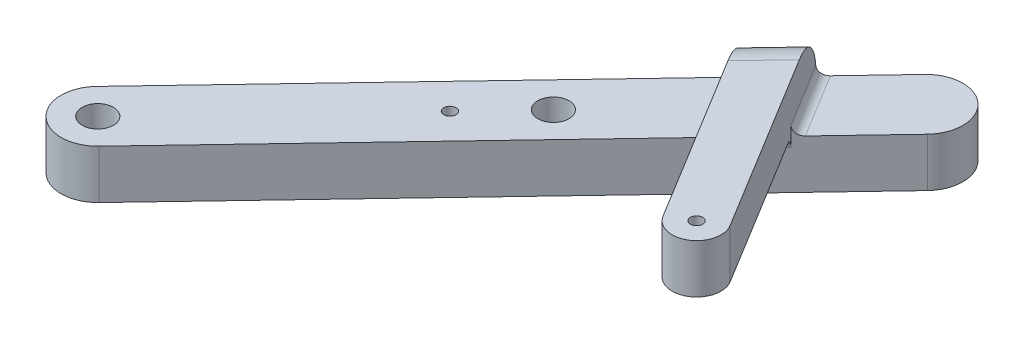
from build123d import *

# Parameters (mm, degrees)
SKETCH1_R           = 3.2000000000000006
SKETCH1_R_2         = 3.2000000000000037
SKETCH1_R_3         = 1.2500000000000047
BOSS_EXTRUDE1_DEPTH = 10
SKETCH1_7_R         = 1.2500000000000122
BOSS_EXTRUDE2_DEPTH = 10
FILLET1_R           = 10
FILLET2_R           = 2
FILLET3_R           = 2


with BuildPart() as part:
    # Sketch1 → Boss-Extrude1 (new body)
    with BuildSketch(Plane(origin=(0, 0, 0), x_dir=(1, 0, 0), z_dir=(0, 1, 0))):
        with BuildLine():
            Line((-9.148889755102248, 0.2602426865805545), (73.5491158361503, 87.21448278577964))
            ThreePointArc((73.5491158361503, 87.21448278577964), (84.15238119180354, 87.48049744252629), (84.41839584855015, 76.87723208687311))
            Line((84.41839584855015, 76.87723208687311), (1.7203902572976446, -10.077008012326013))
            ThreePointArc((1.7203902572976446, -10.077008012326013), (-8.882875098355584, -10.343022669072676), (-9.148889755102248, 0.2602426865805545))
        make_face()
        with Locations(Location((-3.7142497489023008, -4.908382662872731, 0), (0, 0, 270))):
            Circle(SKETCH1_R, mode=Mode.SUBTRACT)
        with Locations(Location((41.769653326286615, 42.91644939168677, 0), (0, 0, 270))):
            Circle(SKETCH1_R_2, mode=Mode.SUBTRACT)
        with Locations(Location((31.432402627380036, 32.047169379286885, 0), (0, 0, 270))):
            Circle(SKETCH1_R_3, mode=Mode.SUBTRACT)
    extrude(amount=-BOSS_EXTRUDE1_DEPTH)

    # Sketch1<7> → Boss-Extrude2 (add)
    with BuildSketch(Plane(origin=(0, 0, 0), x_dir=(1, 0, 0), z_dir=(0, 1, 0))):
        with BuildLine():
            Line((62.691064287297834, 75.79759776372697), (55.55645800762751, 68.29579330036361))
            Line((55.55645800762751, 68.2957933003636), (81.85576990080861, 25.27333022283284))
            ThreePointArc((81.85576990080861, 25.27333022283284), (88.7296482404513, 23.61507916470229), (90.38789929858186, 30.488957504344977))
            Line((90.38789929858186, 30.488957504344977), (62.69106428729781, 75.79759776372696))
        make_face()
        with Locations(Location((86.12183459969525, 27.881143863588914, 0), (0, 0, 270))):
            Circle(SKETCH1_7_R, mode=Mode.SUBTRACT)
    extrude(amount=BOSS_EXTRUDE2_DEPTH)

    # Fillet1
    fillet1_edges = [part.edges().sort_by_distance(p)[0] for p in [
        (59.12376114746267, 10, -72.04669553204529),
    ]]
    fillet(fillet1_edges, radius=FILLET1_R)

    # Fillet2
    # the kernel refuses this fillet: 2 mm, written as the material it adds along each edge
    with BuildSketch(Plane(origin=(52.94864436687145, 0, -72.56185799925024), x_dir=(-0.853212939777324, 0, 0.5215627281512133), z_dir=(0.5215627281512133, 0, 0.853212939777324))) as fillet2_piece_1_section:
        with BuildLine():
            CenterArc((FILLET2_R, -FILLET2_R), FILLET2_R, 90, 90)
            Line((-6.06e-15, -FILLET2_R), (0, 0))
            Line((0, 0), (FILLET2_R, 0))
        make_face()
    fillet2_piece_1 = extrude(amount=25.52914270615122, mode=Mode.PRIVATE)
    fillet2_piece_1 = fillet2_piece_1 & Plane(origin=(61.097194422091576, 1.78e-15, -59.61106783019719), x_dir=(-0.7246186674933254, 0, -0.6891500465937715), z_dir=(-0.6891500465937715, 0, 0.7246186674933254)) * Cylinder(10, 60, mode=Mode.PRIVATE)
    fillet2_piece_1 = split(fillet2_piece_1, bisect_by=Plane(origin=(64.72028775955818, 0.44613502682003076, -56.16531759722836), z_dir=(-0.7246186674933262, 0, -0.6891500465937709)), keep=Keep.TOP, mode=Mode.PRIVATE)
    add(fillet2_piece_1)
    with BuildSketch(Plane(origin=(73.39829996372362, 0, -58.28186756430348), x_dir=(0.853212939777324, 0, -0.5215627281512135), z_dir=(-0.5215627281512135, 0, -0.8532129397773239))) as fillet2_piece_2_section:
        with BuildLine():
            CenterArc((FILLET2_R, -FILLET2_R), FILLET2_R, 90, 90)
            Line((0, -FILLET2_R), (0, 0))
            Line((0, 0), (FILLET2_R, 0))
        make_face()
    fillet2_piece_2 = extrude(amount=25.529142706151212, mode=Mode.PRIVATE)
    fillet2_piece_2 = fillet2_piece_2 & Plane(origin=(68.86970126476385, 1.78e-15, -67.78360381021702), x_dir=(-0.7246186674933254, 0, -0.6891500465937715), z_dir=(-0.6891500465937715, 0, 0.7246186674933254)) * Cylinder(10, 60, mode=Mode.PRIVATE)
    fillet2_piece_2 = split(fillet2_piece_2, bisect_by=Plane(origin=(72.49279460223045, 0.4461350127240334, -64.3378535772482), z_dir=(-0.7246186674933262, 0, -0.6891500465937709)), keep=Keep.TOP, mode=Mode.PRIVATE)
    add(fillet2_piece_2)

    # Fillet3
    fillet3_edges = [part.edges().sort_by_distance(p)[0] for p in [
        (67.22318318313239, 0, -58.797030031508406),
    ]]
    fillet(fillet3_edges, radius=FILLET3_R)


solid = part.part
